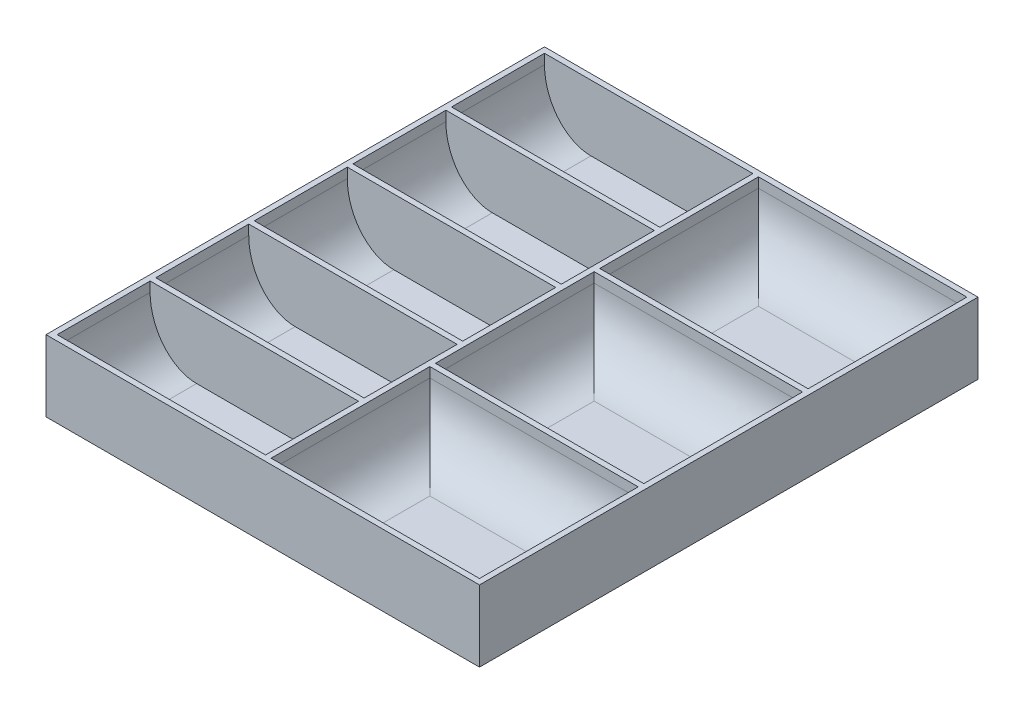
from build123d import *

# Parameters (mm, degrees)
SKETCH1_W           = 140
SKETCH1_H           = 161
BOSS_EXTRUDE1_DEPTH = 1.8
SKETCH1_6_W         = 140
SKETCH1_6_H         = 161
SKETCH1_6_W_2       = 67.3
SKETCH1_6_H_2       = 30.04
SKETCH1_6_H_3       = 51.266666667
SKETCH1_6_H_4       = 51.266666666
BOSS_EXTRUDE2_DEPTH = 21.2
FILLET1_SIZE        = 18
FILLET1_SIZE_2      = 15
FILLET2_SIZE        = 18
FILLET2_SIZE_2      = 15
FILLET3_SIZE        = 18
FILLET3_SIZE_2      = 15
FILLET4_SIZE        = 15
FILLET4_SIZE_2      = 18
FILLET5_SIZE        = 18
FILLET5_SIZE_2      = 15
FILLET6_SIZE        = 18
FILLET6_SIZE_2      = 15
FILLET7_SIZE        = 18
FILLET7_SIZE_2      = 15
FILLET8_SIZE        = 18
FILLET8_SIZE_2      = 15
FILLET9_SIZE        = 18
FILLET9_SIZE_2      = 15
FILLET10_SIZE       = 18
FILLET10_SIZE_2     = 15
FILLET11_SIZE       = 18
FILLET11_SIZE_2     = 15
FILLET12_SIZE       = 15
FILLET12_SIZE_2     = 18
FILLET13_SIZE       = 18
FILLET13_SIZE_2     = 15


with BuildPart() as part:
    # Sketch1 → Boss-Extrude1 (new body)
    with BuildSketch(Plane(origin=(0, 0, 0), x_dir=(1, 0, 0), z_dir=(0, 1, 0))):
        with Locations((70, 80.5)):
            Rectangle(SKETCH1_W, SKETCH1_H)
    extrude(amount=-BOSS_EXTRUDE1_DEPTH)

    # Sketch1<6> → Boss-Extrude2 (add)
    with BuildSketch(Plane(origin=(0, 0, 0), x_dir=(1, 0, 0), z_dir=(0, 1, 0))):
        with Locations((70, 80.5)):
            Rectangle(SKETCH1_6_W, SKETCH1_6_H)
        with Locations((35.45, 16.82)):
            Rectangle(SKETCH1_6_W_2, SKETCH1_6_H_2, mode=Mode.SUBTRACT)
        with Locations((35.45, 144.18)):
            Rectangle(SKETCH1_6_W_2, SKETCH1_6_H_2, mode=Mode.SUBTRACT)
        with Locations((104.55, 27.433333333)):
            Rectangle(SKETCH1_6_W_2, SKETCH1_6_H_3, mode=Mode.SUBTRACT)
        with Locations((104.55, 80.5)):
            Rectangle(SKETCH1_6_W_2, SKETCH1_6_H_4, mode=Mode.SUBTRACT)
        with Locations((104.55, 133.566666666)):
            Rectangle(SKETCH1_6_W_2, SKETCH1_6_H_3, mode=Mode.SUBTRACT)
        with Locations((35.45, 48.66)):
            Rectangle(SKETCH1_6_W_2, SKETCH1_6_H_2, mode=Mode.SUBTRACT)
        with Locations((35.45, 80.5)):
            Rectangle(SKETCH1_6_W_2, SKETCH1_6_H_2, mode=Mode.SUBTRACT)
        with Locations((35.45, 112.34)):
            Rectangle(SKETCH1_6_W_2, SKETCH1_6_H_2, mode=Mode.SUBTRACT)
    extrude(amount=BOSS_EXTRUDE2_DEPTH)

    # Fillet1
    # an asymmetric fillet: 18, 15 mm, written as the material it adds along each edge
    with BuildSketch(Plane(origin=(1.8, 0, -1.8), x_dir=(0, 1, 0), z_dir=(0, 0, -1))) as fillet1_piece_1:
        with BuildLine():
            Bezier((FILLET1_SIZE, 0), (0, 0), (0, FILLET1_SIZE_2), weights=[1, 0.707106781, 1])
            Line((0, FILLET1_SIZE_2), (0, 0))
            Line((0, 0), (FILLET1_SIZE, 0))
        make_face()
    extrude(amount=30.04)

    # Fillet2
    # an asymmetric fillet: 18, 15 mm, written as the material it adds along each edge
    with BuildSketch(Plane(origin=(1.8, 0, -108.68), x_dir=(0, 1, 0), z_dir=(0, 0, 1))) as fillet2_piece_1_section:
        with BuildLine():
            Bezier((FILLET2_SIZE, 0), (0, 0), (0, -FILLET2_SIZE_2), weights=[1, 0.707106781, 1])
            Line((0, -FILLET2_SIZE_2), (0, 0))
            Line((0, 0), (FILLET2_SIZE, 0))
        make_face()
    fillet2_piece_1 = extrude(amount=75.04, mode=Mode.PRIVATE)
    fillet2_piece_1 = split(fillet2_piece_1, bisect_by=Plane(origin=(5.150518803, 4.020622573, -65.48), z_dir=(0, 0, 1)), keep=Keep.TOP, mode=Mode.PRIVATE)
    add(fillet2_piece_1)

    # Fillet3
    # an asymmetric fillet: 18, 15 mm, written as the material it adds along each edge
    with BuildSketch(Plane(origin=(1.8, 0, -20.48), x_dir=(0, 1, 0), z_dir=(0, 0, -1))) as fillet3_piece_1_section:
        with BuildLine():
            Bezier((FILLET3_SIZE, 0), (0, 0), (0, FILLET3_SIZE_2), weights=[1, 0.707106781, 1])
            Line((0, FILLET3_SIZE_2), (0, 0))
            Line((0, 0), (FILLET3_SIZE, 0))
        make_face()
    fillet3_piece_1 = extrude(amount=120.04, mode=Mode.PRIVATE)
    fillet3_piece_1 = split(fillet3_piece_1, bisect_by=Plane(origin=(5.150518803, 4.020622573, -97.32), z_dir=(0, 0, 1)), keep=Keep.TOP, mode=Mode.PRIVATE)
    add(fillet3_piece_1)

    # Fillet4
    # an asymmetric fillet: 18, 15 mm, written as the material it adds along each edge
    with BuildSketch(Plane(origin=(1.8, 0, -172.36), x_dir=(1, 0, 0), z_dir=(0, 0, 1))) as fillet4_piece_1_section:
        with BuildLine():
            Bezier((FILLET4_SIZE, 0), (0, 0), (0, FILLET4_SIZE_2), weights=[1, 0.707106781, 1])
            Line((0, FILLET4_SIZE_2), (0, 0))
            Line((0, 0), (FILLET4_SIZE, 0))
        make_face()
    fillet4_piece_1 = extrude(amount=120.04, mode=Mode.PRIVATE)
    fillet4_piece_1 = split(fillet4_piece_1, bisect_by=Plane(origin=(5.150518803, 4.020622573, -129.16), z_dir=(0, 0, 1)), keep=Keep.TOP, mode=Mode.PRIVATE)
    add(fillet4_piece_1)

    # Fillet5
    # an asymmetric fillet: 18, 15 mm, written as the material it adds along each edge
    with BuildSketch(Plane(origin=(1.8, 0, -84.16), x_dir=(0, 1, 0), z_dir=(0, 0, -1))) as fillet5_piece_1_section:
        with BuildLine():
            Bezier((FILLET5_SIZE, 0), (0, 0), (0, FILLET5_SIZE_2), weights=[1, 0.707106781, 1])
            Line((0, FILLET5_SIZE_2), (0, 0))
            Line((0, 0), (FILLET5_SIZE, 0))
        make_face()
    fillet5_piece_1 = extrude(amount=120.04, mode=Mode.PRIVATE)
    fillet5_piece_1 = split(fillet5_piece_1, bisect_by=Plane(origin=(5.150518803, 4.020622573, -161), z_dir=(0, 0, 1)), keep=Keep.TOP, mode=Mode.PRIVATE)
    add(fillet5_piece_1)

    # Fillet6
    # an asymmetric fillet: 18, 15 mm, written as the material it adds along each edge
    with BuildSketch(Plane(origin=(69.1, 0, -76.84), x_dir=(0, 1, 0), z_dir=(0, 0, 1))) as fillet6_piece_1_section:
        with BuildLine():
            Bezier((FILLET6_SIZE, 0), (0, 0), (0, FILLET6_SIZE_2), weights=[1, 0.707106781, 1])
            Line((0, FILLET6_SIZE_2), (0, 0))
            Line((0, 0), (FILLET6_SIZE, 0))
        make_face()
    fillet6_piece_1 = extrude(amount=75.04, mode=Mode.PRIVATE)
    fillet6_piece_1 = split(fillet6_piece_1, bisect_by=Plane(origin=(65.749481197, 4.020622573, -33.64), z_dir=(0, 0, 1)), keep=Keep.TOP, mode=Mode.PRIVATE)
    add(fillet6_piece_1)

    # Fillet7
    # an asymmetric fillet: 18, 15 mm, written as the material it adds along each edge
    with BuildSketch(Plane(origin=(69.1, 0, 11.36), x_dir=(0, 1, 0), z_dir=(0, 0, -1))) as fillet7_piece_1_section:
        with BuildLine():
            Bezier((FILLET7_SIZE, 0), (0, 0), (0, -FILLET7_SIZE_2), weights=[1, 0.707106781, 1])
            Line((0, -FILLET7_SIZE_2), (0, 0))
            Line((0, 0), (FILLET7_SIZE, 0))
        make_face()
    fillet7_piece_1 = extrude(amount=120.04, mode=Mode.PRIVATE)
    fillet7_piece_1 = split(fillet7_piece_1, bisect_by=Plane(origin=(65.749481197, 4.020622573, -65.48), z_dir=(0, 0, 1)), keep=Keep.TOP, mode=Mode.PRIVATE)
    fillet7_piece_1 = split(fillet7_piece_1, bisect_by=Plane(origin=(65.749481197, 4.020622573, 0), z_dir=(0, 0, -1)), keep=Keep.TOP, mode=Mode.PRIVATE)
    add(fillet7_piece_1)

    # Fillet8
    # an asymmetric fillet: 18, 15 mm, written as the material it adds along each edge
    with BuildSketch(Plane(origin=(69.1, 0, -95.52), x_dir=(0, 1, 0), z_dir=(0, 0, 1))) as fillet8_piece_1:
        with BuildLine():
            Bezier((FILLET8_SIZE, 0), (0, 0), (0, FILLET8_SIZE_2), weights=[1, 0.707106781, 1])
            Line((0, FILLET8_SIZE_2), (0, 0))
            Line((0, 0), (FILLET8_SIZE, 0))
        make_face()
    extrude(amount=75.04)

    # Fillet9
    # an asymmetric fillet: 18, 15 mm, written as the material it adds along each edge
    with BuildSketch(Plane(origin=(69.1, 0, -52.32), x_dir=(0, 1, 0), z_dir=(0, 0, -1))) as fillet9_piece_1:
        with BuildLine():
            Bezier((FILLET9_SIZE, 0), (0, 0), (0, -FILLET9_SIZE_2), weights=[1, 0.707106781, 1])
            Line((0, -FILLET9_SIZE_2), (0, 0))
            Line((0, 0), (FILLET9_SIZE, 0))
        make_face()
    extrude(amount=75.04)

    # Fillet10
    # an asymmetric fillet: 18, 15 mm, written as the material it adds along each edge
    with BuildSketch(Plane(origin=(69.1, 0, -159.2), x_dir=(0, 1, 0), z_dir=(0, 0, 1))) as fillet10_piece_1:
        with BuildLine():
            Bezier((FILLET10_SIZE, 0), (0, 0), (0, FILLET10_SIZE_2), weights=[1, 0.707106781, 1])
            Line((0, FILLET10_SIZE_2), (0, 0))
            Line((0, 0), (FILLET10_SIZE, 0))
        make_face()
    extrude(amount=75.04)

    # Fillet11
    # an asymmetric fillet: 18, 15 mm, written as the material it adds along each edge
    with BuildSketch(Plane(origin=(138.2, 0, -1.8), x_dir=(0, 1, 0), z_dir=(-1, 0, 0))) as fillet11_piece_1:
        with BuildLine():
            Bezier((FILLET11_SIZE, 0), (0, 0), (0, FILLET11_SIZE_2), weights=[1, 0.707106781, 1])
            Line((0, FILLET11_SIZE_2), (0, 0))
            Line((0, 0), (FILLET11_SIZE, 0))
        make_face()
    extrude(amount=67.3)
    with BuildSketch(Plane(origin=(138.2, 0, -98.066666667), x_dir=(0, 1, 0), z_dir=(0, 0, 1))) as fillet11_piece_2_section:
        with BuildLine():
            Bezier((FILLET11_SIZE, 0), (0, 0), (0, FILLET11_SIZE_2), weights=[1, 0.707106781, 1])
            Line((0, FILLET11_SIZE_2), (0, 0))
            Line((0, 0), (FILLET11_SIZE, 0))
        make_face()
    fillet11_piece_2 = extrude(amount=96.266666667, mode=Mode.PRIVATE)
    fillet11_piece_2 = split(fillet11_piece_2, bisect_by=Plane(origin=(134.849481197, 4.020622573, -54.866666667), z_dir=(0, 0, 1)), keep=Keep.TOP, mode=Mode.PRIVATE)
    add(fillet11_piece_2)
    with BuildSketch(Plane(origin=(25.9, 0, -53.066666667), x_dir=(0, 1, 0), z_dir=(1, 0, 0))) as fillet11_piece_3_section:
        with BuildLine():
            Bezier((FILLET11_SIZE, 0), (0, 0), (0, FILLET11_SIZE_2), weights=[1, 0.707106781, 1])
            Line((0, FILLET11_SIZE_2), (0, 0))
            Line((0, 0), (FILLET11_SIZE, 0))
        make_face()
    fillet11_piece_3 = extrude(amount=112.3, mode=Mode.PRIVATE)
    fillet11_piece_3 = split(fillet11_piece_3, bisect_by=Plane(origin=(69.1, 4.020622573, -49.716147863), z_dir=(1, 0, 0)), keep=Keep.TOP, mode=Mode.PRIVATE)
    add(fillet11_piece_3)
    with BuildSketch(Plane(origin=(70.9, 0, -1.8), x_dir=(0, 1, 0), z_dir=(0, 0, -1))) as fillet11_piece_4_section:
        with BuildLine():
            Bezier((FILLET11_SIZE, 0), (0, 0), (0, FILLET11_SIZE_2), weights=[1, 0.707106781, 1])
            Line((0, FILLET11_SIZE_2), (0, 0))
            Line((0, 0), (FILLET11_SIZE, 0))
        make_face()
    fillet11_piece_4 = extrude(amount=96.266666667, mode=Mode.PRIVATE)
    fillet11_piece_4 = split(fillet11_piece_4, bisect_by=Plane(origin=(74.250518803, 4.020622573, -54.866666667), z_dir=(0, 0, 1)), keep=Keep.TOP, mode=Mode.PRIVATE)
    add(fillet11_piece_4)

    # Fillet12
    # an asymmetric fillet: 18, 15 mm, written as the material it adds along each edge
    with BuildSketch(Plane(origin=(183.2, 0, -54.866666667), x_dir=(0, 0, -1), z_dir=(-1, 0, 0))) as fillet12_piece_1_section:
        with BuildLine():
            Bezier((FILLET12_SIZE, 0), (0, 0), (0, -FILLET12_SIZE_2), weights=[1, 0.707106781, 1])
            Line((0, -FILLET12_SIZE_2), (0, 0))
            Line((0, 0), (FILLET12_SIZE, 0))
        make_face()
    fillet12_piece_1 = extrude(amount=112.3, mode=Mode.PRIVATE)
    fillet12_piece_1 = split(fillet12_piece_1, bisect_by=Plane(origin=(140, 0.235162662, -66.57181515), z_dir=(-1, 0, 0)), keep=Keep.TOP, mode=Mode.PRIVATE)
    add(fillet12_piece_1)
    with BuildSketch(Plane(origin=(138.2, 0, -106.133333333), x_dir=(0, 1, 0), z_dir=(0, 0, 1))) as fillet12_piece_2:
        with BuildLine():
            Bezier((FILLET12_SIZE_2, 0), (0, 0), (0, FILLET12_SIZE), weights=[1, 0.707106781, 1])
            Line((0, FILLET12_SIZE), (0, 0))
            Line((0, 0), (FILLET12_SIZE_2, 0))
        make_face()
    extrude(amount=96.266666667)
    with BuildSketch(Plane(origin=(70.9, 0, -106.133333333), x_dir=(0, 0, 1), z_dir=(1, 0, 0))) as fillet12_piece_3_section:
        with BuildLine():
            Bezier((FILLET12_SIZE, 0), (0, 0), (0, -FILLET12_SIZE_2), weights=[1, 0.707106781, 1])
            Line((0, -FILLET12_SIZE_2), (0, 0))
            Line((0, 0), (FILLET12_SIZE, 0))
        make_face()
    fillet12_piece_3 = extrude(amount=112.3, mode=Mode.PRIVATE)
    fillet12_piece_3 = split(fillet12_piece_3, bisect_by=Plane(origin=(140, 0.235162662, -94.42818485), z_dir=(-1, 0, 0)), keep=Keep.TOP, mode=Mode.PRIVATE)
    add(fillet12_piece_3)
    with BuildSketch(Plane(origin=(70.9, 0, -9.866666667), x_dir=(1, 0, 0), z_dir=(0, 0, -1))) as fillet12_piece_4:
        with BuildLine():
            Bezier((FILLET12_SIZE, 0), (0, 0), (0, -FILLET12_SIZE_2), weights=[1, 0.707106781, 1])
            Line((0, -FILLET12_SIZE_2), (0, 0))
            Line((0, 0), (FILLET12_SIZE, 0))
        make_face()
    extrude(amount=96.266666667)

    # Fillet13
    # an asymmetric fillet: 18, 15 mm, written as the material it adds along each edge
    with BuildSketch(Plane(origin=(138.2, 0, -107.933333333), x_dir=(0, 1, 0), z_dir=(-1, 0, 0))) as fillet13_piece_1_section:
        with BuildLine():
            Bezier((FILLET13_SIZE, 0), (0, 0), (0, FILLET13_SIZE_2), weights=[1, 0.707106781, 1])
            Line((0, FILLET13_SIZE_2), (0, 0))
            Line((0, 0), (FILLET13_SIZE, 0))
        make_face()
    fillet13_piece_1 = extrude(amount=112.3, mode=Mode.PRIVATE)
    fillet13_piece_1 = split(fillet13_piece_1, bisect_by=Plane(origin=(69.1, 4.020622573, -111.283852137), z_dir=(1, 0, 0)), keep=Keep.TOP, mode=Mode.PRIVATE)
    add(fillet13_piece_1)
    with BuildSketch(Plane(origin=(138.2, 0, -159.2), x_dir=(0, 1, 0), z_dir=(0, 0, 1)), Plane(origin=(70.9, 0, -62.933333333), x_dir=(0, 1, 0), z_dir=(0, 0, -1))) as fillet13_piece_2:
        with BuildLine():
            Bezier((FILLET13_SIZE, 0), (0, 0), (0, FILLET13_SIZE_2), weights=[1, 0.707106781, 1])
            Line((0, FILLET13_SIZE_2), (0, 0))
            Line((0, 0), (FILLET13_SIZE, 0))
        make_face()
    extrude(amount=96.266666667)
    with BuildSketch(Plane(origin=(70.9, 0, -159.2), x_dir=(0, 1, 0), z_dir=(1, 0, 0))) as fillet13_piece_3:
        with BuildLine():
            Bezier((FILLET13_SIZE, 0), (0, 0), (0, FILLET13_SIZE_2), weights=[1, 0.707106781, 1])
            Line((0, FILLET13_SIZE_2), (0, 0))
            Line((0, 0), (FILLET13_SIZE, 0))
        make_face()
    extrude(amount=67.3)


solid = part.part
